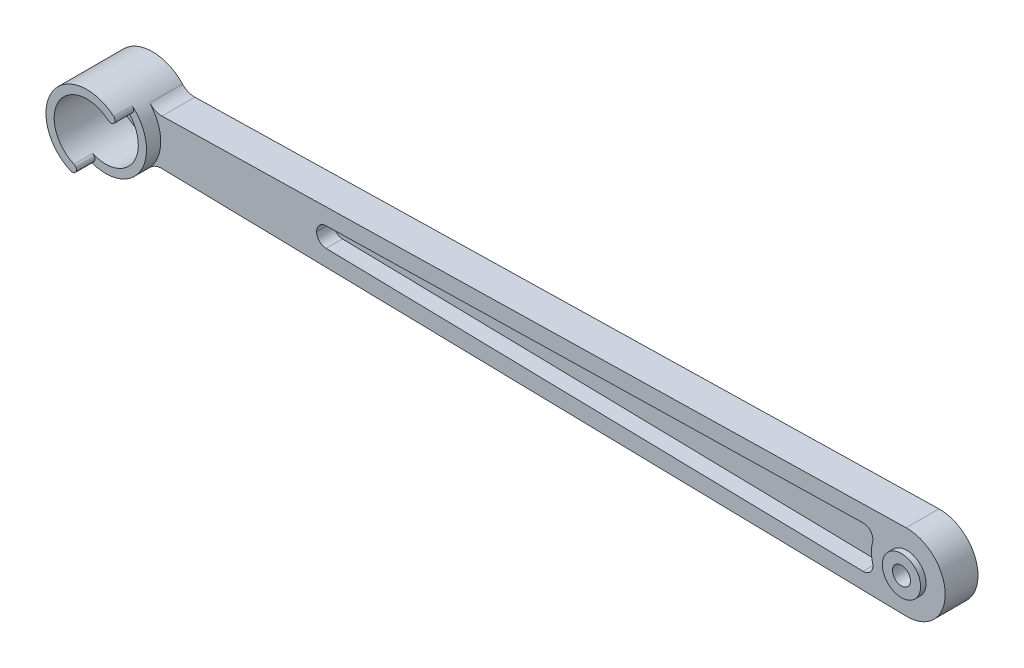
from build123d import *
from build123d.topology import SkipClean

# Parameters (mm, degrees)
SKETCH1_R           = 6
BOSS_EXTRUDE1_DEPTH = 6
SKETCH2_R           = 3.5
BOSS_EXTRUDE2_DEPTH = 1
SKETCH4_R           = 1.65
CUT_EXTRUDE1_DEPTH  = 12
SKETCH6_R           = 6
SKETCH6_R_2         = 5
BOSS_EXTRUDE4_DEPTH = 0.6
FILLET3_R           = 3
BOSS_EXTRUDE5_DEPTH = 6
FILLET1_START       = 6
FILLET1_DEPTH       = 7
CUT_EXTRUDE2_DEPTH  = 3
SKETCH9_R           = 7.5
SKETCH9_R_2         = 6
BOSS_EXTRUDE6_DEPTH = 2.6


with BuildPart() as part:
    # Sketch1 → Boss-Extrude1 (new body)
    with BuildSketch(Plane.XY):
        with BuildLine():
            ThreePointArc((-0.145833333, -6.998480738), (7, 0), (-0.145833333, 6.998480738))
            Line((-0.145833333, 6.998480738), (-137.740421511, 4.131304533))
            ThreePointArc((-137.740421511, 4.131304533), (-151.5, 0), (-137.740421511, -4.131304533))
            Line((-137.740421511, -4.131304533), (-0.145833333, -6.998480738))
        make_face()
        with Locations((-144, 0)):
            Circle(SKETCH1_R, mode=Mode.SUBTRACT)
    extrude(amount=BOSS_EXTRUDE1_DEPTH)

    # Sketch2 → Boss-Extrude2 (add)
    with BuildSketch(Plane.XY.offset(6)):
        Circle(SKETCH2_R)
    extrude(amount=BOSS_EXTRUDE2_DEPTH)

    # Sketch4 → Cut-Extrude1 (cut)
    with BuildSketch(Plane.XY.offset(7)):
        Circle(SKETCH4_R)
    extrude(amount=-CUT_EXTRUDE1_DEPTH, mode=Mode.SUBTRACT)

    # Sketch6 → Boss-Extrude4 (add)
    with BuildSketch(Plane(origin=(0, 0, 0), x_dir=(-1, 0, 0), z_dir=(0, 0, -1))):
        with Locations((144, 0)):
            Circle(SKETCH6_R)
        with Locations((144, 0)):
            Circle(SKETCH6_R_2, mode=Mode.SUBTRACT)
    extrude(amount=-BOSS_EXTRUDE4_DEPTH)

    # Fillet3
    fillet3_edges = [part.edges().sort_by_distance(p)[0] for p in [
        (-137.740421511, -4.131304533, 3),
        (-137.740421511, 4.131304533, 3),
    ]]
    fillet(fillet3_edges, radius=FILLET3_R)

    # Sketch7 → Boss-Extrude5 (add)
    with SkipClean():  # the faces are left unmerged after this step: merging them gives an invalid solid
        with BuildSketch(Plane.XY.offset(6)):
            with BuildLine():
                ThreePointArc((-145.753823306, -5.737952929), (-149.088514051, 3.179154723), (-139.612167999, 4.092301349))
                Line((-139.612167999, 4.092301349), (-138.515209999, 5.115376687))
                ThreePointArc((-138.515209999, 5.115376687), (-150.360642563, 3.973943404), (-146.192279132, -7.172441161))
                Line((-146.192279132, -7.172441161), (-145.753823306, -5.737952929))
            make_face()
        extrude(amount=BOSS_EXTRUDE5_DEPTH)

    # Fillet1: read off the stored shape, not the designer's step
    # Fillet1 outline → Fillet1 (cut)
    with SkipClean():  # the faces are left unmerged after this step: merging them gives an invalid solid
        with BuildSketch(Plane.XY.offset(FILLET1_START)):
            with BuildLine():
                ThreePointArc((-145.753823306, -5.737952929), (-146.070376054, -5.631477869), (-146.380513939, -5.507554211))
                ThreePointArc((-146.380513939, -5.507554211), (-145.99732404, -5.881238582), (-145.960834066, -6.4152264))
                Line((-145.960834066, -6.4152264), (-145.753823306, -5.737952929))
            make_face()
            with BuildLine():
                Line((-146.192279132, -7.172441161), (-145.960834066, -6.4152264))
                ThreePointArc((-145.960834066, -6.4152264), (-146.363318277, -6.876752629), (-146.975642424, -6.884442763))
                ThreePointArc((-146.975642424, -6.884442763), (-146.587970068, -7.039347337), (-146.192279132, -7.172441161))
            make_face()
            with BuildLine():
                ThreePointArc((-139.094254686, 4.575332001), (-139.590167355, 4.373973779), (-140.094037649, 4.554498667))
                ThreePointArc((-140.094037649, 4.554498667), (-139.846668472, 4.330108223), (-139.612167999, 4.092301349))
                Line((-139.612167999, 4.092301349), (-139.094254686, 4.575332001))
            make_face()
            with BuildLine():
                ThreePointArc((-139.117547061, 5.693123334), (-138.855955133, 5.139436001), (-139.094254686, 4.575332001))
                Line((-139.094254686, 4.575332001), (-138.515209999, 5.115376687))
                ThreePointArc((-138.515209999, 5.115376687), (-138.80833559, 5.412635279), (-139.117547061, 5.693123334))
            make_face()
        extrude(amount=FILLET1_DEPTH, mode=Mode.SUBTRACT)

    # Sketch8 → Cut-Extrude2 (cut)
    with SkipClean():  # the faces are left unmerged after this step: merging them gives an invalid solid
        with BuildSketch(Plane.XY.offset(6)):
            with BuildLine():
                Line((-8.018864585, 3.833772393), (-106.262176435, 1.786592415))
                ThreePointArc((-106.262176435, 1.786592415), (-107.476577581, 1.260839283), (-107.975717263, 0.035259389))
                ThreePointArc((-107.975717263, 0.035259389), (-107.975700008, 0), (-107.975717263, -0.035259389))
                ThreePointArc((-107.975717263, -0.035259389), (-107.476577581, -1.260839283), (-106.262176435, -1.786592415))
                Line((-106.262176435, -1.786592415), (-8.018864585, -3.833772393))
                ThreePointArc((-8.018864585, -3.833772393), (-6.60867738, -3.168296566), (-6.289168562, -1.642059316))
                ThreePointArc((-6.289168562, -1.642059316), (-6.5, 0), (-6.289168562, 1.642059316))
                ThreePointArc((-6.289168562, 1.642059316), (-6.60867738, 3.168296566), (-8.018864585, 3.833772393))
            make_face()
        extrude(amount=-CUT_EXTRUDE2_DEPTH, mode=Mode.SUBTRACT)

    # Sketch9 → Boss-Extrude6 (add)
    with BuildSketch(Plane.XY.offset(6)):
        with Locations(Location((-144, 0, 0), (0, 0, 246.624693124))):
            Circle(SKETCH9_R)
        with Locations(Location((-144, 0, 0), (0, 0, 180))):
            Circle(SKETCH9_R_2, mode=Mode.SUBTRACT)
    extrude(amount=BOSS_EXTRUDE6_DEPTH)


solid = part.part
